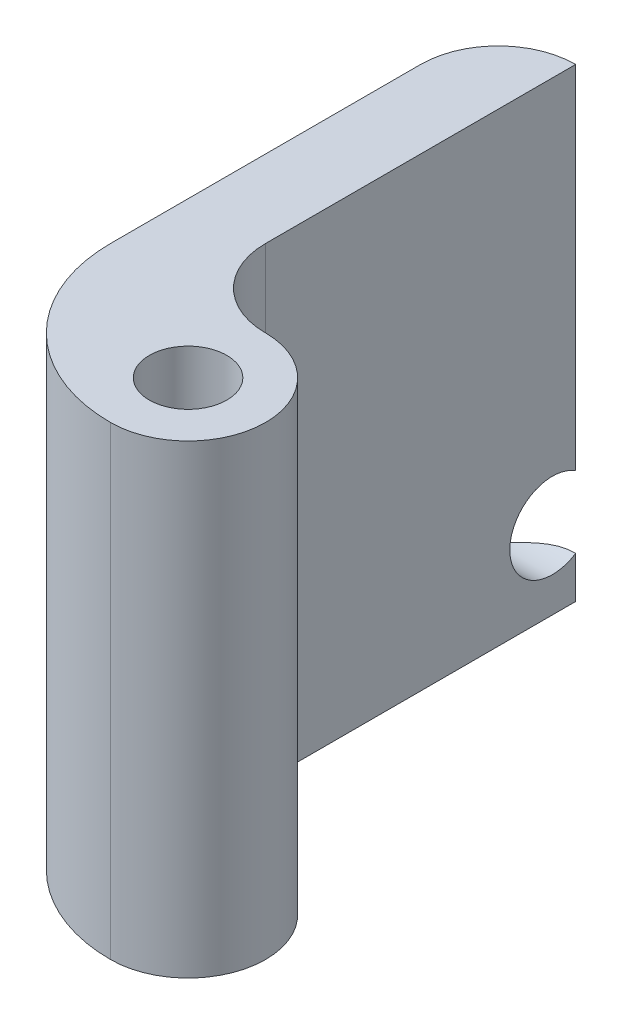
from build123d import *

# Parameters (mm, degrees)
SKETCH1_R           = 2.5
BOSS_EXTRUDE1_DEPTH = 30
FILLET1_R           = 5
SKETCH2_R           = 2.75
CUT_EXTRUDE1_DEPTH  = 124


with BuildPart() as part:
    # Sketch1 → Boss-Extrude1 (new body)
    with BuildSketch(Plane(origin=(0, 0, 0), x_dir=(1, 0, 0), z_dir=(0, 1, 0))):
        with BuildLine():
            Line((-5, 30), (-5, 10))
            ThreePointArc((-5, 10), (-3.535533906, 6.464466094), (0, 5))
            ThreePointArc((0, 5), (5, 0), (0, -5))
            ThreePointArc((0, -5), (-7.071067812, -2.071067812), (-10, 5))
            Line((-10, 5), (-10, 30))
            Line((-10, 30), (-5, 30))
        make_face()
        with Locations(Location((0, 0, 0), (0, 0, 270))):
            Circle(SKETCH1_R, mode=Mode.SUBTRACT)
    extrude(amount=BOSS_EXTRUDE1_DEPTH)

    # Fillet1
    fillet1_edges = [part.edges().sort_by_distance(p)[0] for p in [
        (-10, 15, -30),
    ]]
    fillet(fillet1_edges, radius=FILLET1_R - 0.0001)  # a hair under: the kernel refuses the full size

    # Sketch2 → Cut-Extrude1 (cut)
    with BuildSketch(Plane(origin=(5, -405, -405), x_dir=(0, 0, -1), z_dir=(1, 0, 0))):
        with Locations((-376.5, 410)):
            Circle(SKETCH2_R)
    extrude(amount=-CUT_EXTRUDE1_DEPTH, mode=Mode.SUBTRACT)


solid = part.part
